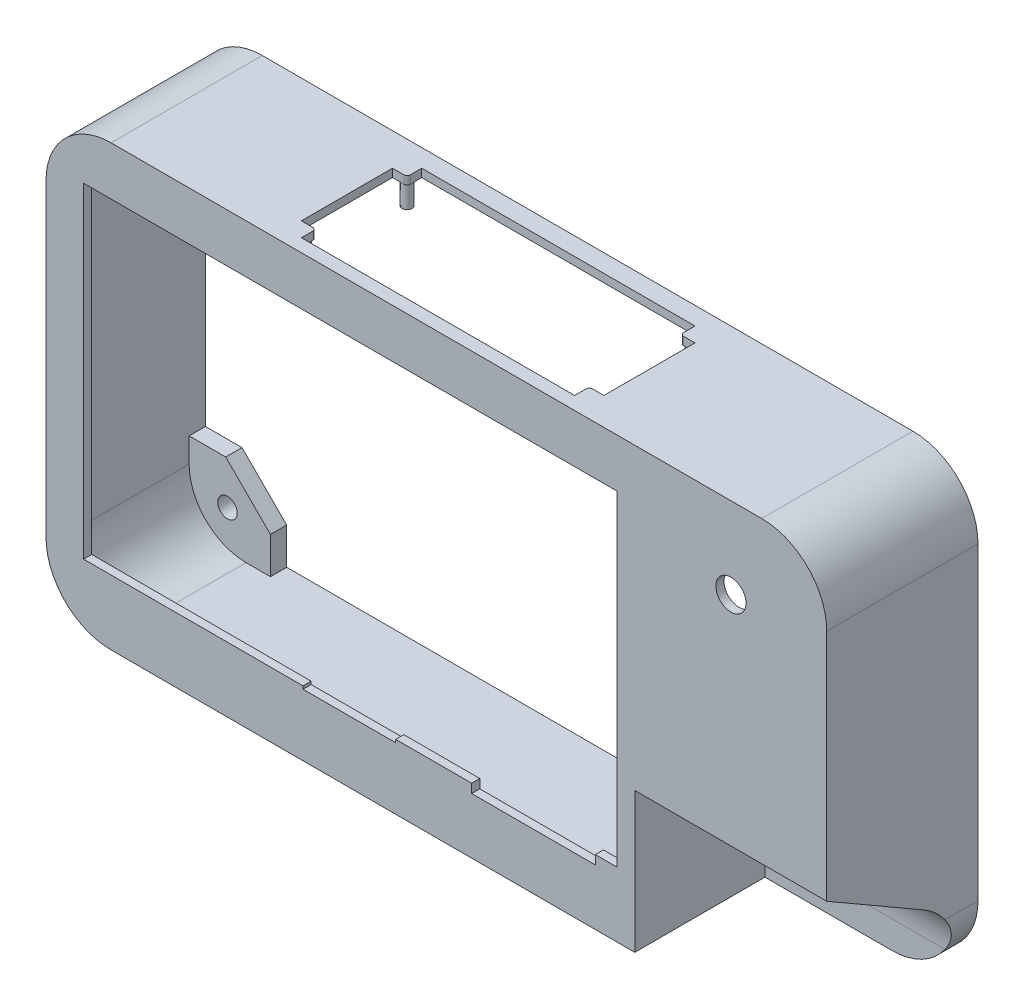
from build123d import *

# Parameters (mm, degrees)
BOSS_EXTRUDE1_DEPTH      = 40
CUT_EXTRUDE2_DEPTH       = 40
CUT_EXTRUDE3_DEPTH       = 59
SHELL2_START             = -40
SHELL2_DEPTH             = 37.5
SHELL2_START_2           = -117.5
SHELL2_2_DEPTH           = 235
SHELL2_3_DEPTH           = 176
SHELL2_START_3           = -2.5
SHELL2_4_DEPTH           = 42.5
CUT_EXTRUDE8_DEPTH       = 5
SKETCH8_W                = 5
SKETCH8_H                = 5
SKETCH8_RX               = 1
SKETCH8_RY               = 1
BOSS_EXTRUDE2_DEPTH      = 3.1
SKETCH9_R                = 4.635276172
CUT_EXTRUDE9_DEPTH       = 5
CUT_EXTRUDE10_DEPTH      = 144.374509589
CUT_EXTRUDE10_DEPTH_BACK = 144.374509589
SKETCH10_W               = 67.959096348
SKETCH10_H               = 169.269533221
FILLET2_R                = 20
SKETCH11_W               = 28.5
SKETCH11_H               = 0.9
CUT_EXTRUDE11_DEPTH      = 15
CUT_EXTRUDE12_DEPTH      = 7
SKETCH13_R               = 1.5
BOSS_EXTRUDE3_DEPTH      = 7
SKETCH14_W               = 22.744879455
SKETCH14_H               = 1.378979665
BOSS_EXTRUDE4_DEPTH      = 16
SKETCH15_R               = 1
CUT_EXTRUDE13_DEPTH      = 6
SKETCH17_W               = 16.744879455
SKETCH17_H               = 4.971074248
SKETCH17_W_2             = 11.65
SKETCH17_H_2             = 5.028925752
CUT_EXTRUDE14_DEPTH      = 6
SKETCH16_W               = 5.703112467
SKETCH16_H               = 1.378979665
BOSS_EXTRUDE5_DEPTH      = 25
BOSS_EXTRUDE6_DEPTH      = 8
BOSS_EXTRUDE6_DEPTH_BACK = 14
SKETCH20_W               = 5
SKETCH20_H               = 1.378979665
BOSS_EXTRUDE7_DEPTH      = 8
SKETCH21_R               = 1
CUT_EXTRUDE15_DEPTH      = 8
BOSS_EXTRUDE8_START      = -5
SKETCH22_R               = 3
BOSS_EXTRUDE8_DEPTH      = 5
MIRROR3_START            = -5
MIRROR3_COPY_1_SKETCH_R  = 3
MIRROR3_COPY_1_DEPTH     = 5


with BuildPart() as part:
    # Sketch2 → Boss-Extrude1 (new, symmetric)
    with BuildSketch(Plane.XY):
        with BuildLine():
            Line((-100, -67.5), (100, -67.5))
            ThreePointArc((100, -67.5), (114.142135624, -61.642135624), (120, -47.5))
            Line((120, -47.5), (120, 47.5))
            ThreePointArc((120, 47.5), (114.142135624, 61.642135624), (100, 67.5))
            Line((100, 67.5), (-100, 67.5))
            ThreePointArc((-100, 67.5), (-114.142135624, 61.642135624), (-120, 47.5))
            Line((-120, 47.5), (-120, -47.5))
            ThreePointArc((-120, -47.5), (-114.142135624, -61.642135624), (-100, -67.5))
        make_face()
    extrude(amount=BOSS_EXTRUDE1_DEPTH, both=True)

    # Sketch3 → Cut-Extrude2 (cut)
    with BuildSketch(Plane.XY.offset(40)):
        with BuildLine():
            Line((61, -47.5), (61, -67.5))
            Line((61, -67.5), (100, -67.5))
            ThreePointArc((100, -67.5), (114.142135624, -61.642135624), (120, -47.5))
            Line((120, -47.5), (61, -47.5))
        make_face()
    extrude(amount=-CUT_EXTRUDE2_DEPTH, mode=Mode.SUBTRACT)

    # Sketch4 → Cut-Extrude3 (cut)
    with BuildSketch(Plane(origin=(120, 0, 0), x_dir=(0, 0, -1), z_dir=(1, 0, 0))):
        Polygon((0, -47.5), (-40, -24.405989232), (-40, -47.5), align=None)
    extrude(amount=-CUT_EXTRUDE3_DEPTH, mode=Mode.SUBTRACT)

    # Shell2: read off the stored shape, not the designer's step
    # Shell2 outline → Shell2 (cut)
    with BuildSketch(Plane.XY.offset(SHELL2_START)):
        with BuildLine():
            Line((58.5, -65), (100, -65))
            ThreePointArc((100, -65), (112.374368671, -59.874368671), (117.5, -47.5))
            Line((117.5, -47.5), (117.5, 47.5))
            ThreePointArc((117.5, 47.5), (112.374368671, 59.874368671), (100, 65))
            Line((100, 65), (-100, 65))
            ThreePointArc((-100, 65), (-112.374368671, 59.874368671), (-117.5, 47.5))
            Line((-117.5, 47.5), (-117.5, -47.5))
            ThreePointArc((-117.5, -47.5), (-112.374368671, -59.874368671), (-100, -65))
            Line((-100, -65), (58.5, -65))
        make_face()
    extrude(amount=SHELL2_DEPTH, mode=Mode.SUBTRACT)

    # Shell2 2 outline → Shell2 2 (cut)
    with BuildSketch(Plane.YZ.offset(SHELL2_START_2)):
        Polygon((-22.962613559, 37.5), (-46.056624327, -2.5), (65, -2.5), (65, 37.5), align=None)
    extrude(amount=SHELL2_2_DEPTH, mode=Mode.SUBTRACT)

    # Shell2 3 outline → Shell2 3 (cut)
    with BuildSketch(Plane.YZ.offset(SHELL2_START_2)):
        Polygon((-65, 37.5), (-65, -2.5), (-46.056624327, -2.5), (-22.962613559, 37.5), align=None)
    extrude(amount=SHELL2_3_DEPTH, mode=Mode.SUBTRACT)

    # Shell2 4 outline → Shell2 4 (add)
    with BuildSketch(Plane.XY.offset(SHELL2_START_3)):
        with BuildLine():
            ThreePointArc((-100, -65), (-112.374368671, -59.874368671), (-117.5, -47.5))
            Line((-117.5, -47.5), (-117.5, -57.182458366))
            ThreePointArc((-117.5, -57.182458366), (-114.142135624, -61.642135624), (-109.682458366, -65))
            Line((-109.682458366, -65), (-100, -65))
        make_face()
        with BuildLine():
            ThreePointArc((-117.5, 47.5), (-112.374368671, 59.874368671), (-100, 65))
            Line((-100, 65), (-109.682458366, 65))
            ThreePointArc((-109.682458366, 65), (-114.142135624, 61.642135624), (-117.5, 57.182458366))
            Line((-117.5, 57.182458366), (-117.5, 47.5))
        make_face()
        with BuildLine():
            ThreePointArc((117.5, 57.182458366), (114.142135624, 61.642135624), (109.682458366, 65))
            Line((109.682458366, 65), (100, 65))
            ThreePointArc((100, 65), (112.374368671, 59.874368671), (117.5, 47.5))
            Line((117.5, 47.5), (117.5, 57.182458366))
        make_face()
    extrude(amount=SHELL2_4_DEPTH)

    # Sketch5 → Cut-Extrude8 (cut)
    with BuildSketch(Plane(origin=(0, -35.625, 20.56810334), x_dir=(1, 0, 0), z_dir=(0, -0.8660254037844417, 0.4999999999999947))):
        Polygon((101.124755189, 17.899421729), (78.474755189, 17.899421729), (78.474755189, 5.754854046), (78.474755189, 3.799421729), (101.124755189, 3.799421729), (101.124755189, 5.754854046), align=None)
    extrude(amount=-CUT_EXTRUDE8_DEPTH, mode=Mode.SUBTRACT)

    # Sketch8 → Boss-Extrude2 (add)
    # profile 1 of 4: a face of its own
    with BuildSketch(Plane(origin=(0, 0, 37.5), x_dir=(-1, 0, 0), z_dir=(0, 0, -1))):
        with Locations((-103.1, 53)):
            Rectangle(SKETCH8_W, SKETCH8_H)
        with Locations(Location((-103.1, 53), (0, 0, 135))):
            Ellipse(SKETCH8_RX, SKETCH8_RY, mode=Mode.SUBTRACT)
    # profile 2 of 4: a face of its own
    with BuildSketch(Plane(origin=(0, 0, 37.5), x_dir=(-1, 0, 0), z_dir=(0, 0, -1))):
        with Locations((-90.6, 53)):
            Rectangle(SKETCH8_W, SKETCH8_H)
        with Locations(Location((-90.6, 53), (0, 0, 135))):
            Ellipse(SKETCH8_RX, SKETCH8_RY, mode=Mode.SUBTRACT)
    # profile 3 of 4: a face of its own
    with BuildSketch(Plane(origin=(0, 0, 37.5), x_dir=(-1, 0, 0), z_dir=(0, 0, -1))):
        with Locations((-90.6, 32)):
            Rectangle(SKETCH8_W, SKETCH8_H)
        with Locations(Location((-90.6, 32), (0, 0, 135))):
            Ellipse(SKETCH8_RX, SKETCH8_RY, mode=Mode.SUBTRACT)
    # profile 4 of 4: a face of its own
    with BuildSketch(Plane(origin=(0, 0, 37.5), x_dir=(-1, 0, 0), z_dir=(0, 0, -1))):
        with Locations((-103.1, 32)):
            Rectangle(SKETCH8_W, SKETCH8_H)
        with Locations(Location((-103.1, 32), (0, 0, 135))):
            Ellipse(SKETCH8_RX, SKETCH8_RY, mode=Mode.SUBTRACT)
    extrude(amount=BOSS_EXTRUDE2_DEPTH)

    # Sketch9 → Cut-Extrude9 (cut)
    with BuildSketch(Plane.XY.offset(40)):
        with Locations((90.55, 42.5)):
            Circle(SKETCH9_R)
    extrude(amount=-CUT_EXTRUDE9_DEPTH, mode=Mode.SUBTRACT)

    # Sketch10 → Cut-Extrude10 (cut, two sides: drawn at the far end of the back side and taken through both)
    with BuildSketch(Plane(origin=(0, 0, 0), x_dir=(0, 0, -1), z_dir=(1, 0, 0)).offset(-CUT_EXTRUDE10_DEPTH_BACK)):
        with Locations((40.479548174, -4.240634214)):
            Rectangle(SKETCH10_W, SKETCH10_H)
    extrude(amount=CUT_EXTRUDE10_DEPTH + CUT_EXTRUDE10_DEPTH_BACK, mode=Mode.SUBTRACT)

    # Fillet2
    fillet2_edges = [part.edges().sort_by_distance(p)[0] for p in [
        (90.5, -47.5, 0),
        (88, -46.056624327, -2.5),
    ]]
    fillet(fillet2_edges, radius=FILLET2_R)

    # Sketch11 → Cut-Extrude11 (cut)
    with BuildSketch(Plane.XY.offset(40)):
        Polygon((-12.5, -47.55), (10.85, -47.55), (10.85, -47.8), (10.85, -50.3), (48.85, -50.3), (48.85, -47.8), (48.85, -47.55), (55.55, -47.55), (55.55, 52.55), (-108.45, 52.55), (-108.45, -47.55), (-41, -47.55), align=None)
        with Locations((-26.75, -48)):
            Rectangle(SKETCH11_W, SKETCH11_H)
    extrude(amount=-CUT_EXTRUDE11_DEPTH, mode=Mode.SUBTRACT)

    # Sketch12 → Cut-Extrude12 (cut)
    with BuildSketch(Plane(origin=(0, 67.5, 0), x_dir=(1, 0, 0), z_dir=(0, 1, 0))):
        with BuildLine():
            Line((-50, -3.5), (-50, -31.5))
            Line((-50, -31.5), (-46.5, -31.5))
            ThreePointArc((-46.5, -31.5), (-45.792893219, -31.792893219), (-45.5, -32.5))
            Line((-45.5, -32.5), (-45.5, -36))
            Line((-45.5, -36), (38.5, -36))
            Line((38.5, -36), (38.5, -32.5))
            ThreePointArc((38.5, -32.5), (38.792893219, -31.792893219), (39.5, -31.5))
            Line((39.5, -31.5), (43, -31.5))
            Line((43, -31.5), (43, -3.5))
            Line((43, -3.5), (39.5, -3.5))
            ThreePointArc((39.5, -3.5), (38.792893219, -3.207106781), (38.5, -2.5))
            Line((38.5, -2.5), (38.5, 1))
            Line((38.5, 1), (-45.5, 1))
            Line((-45.5, 1), (-45.5, -2.5))
            ThreePointArc((-45.5, -2.5), (-45.792893219, -3.207106781), (-46.5, -3.5))
            Line((-46.5, -3.5), (-50, -3.5))
        make_face()
    extrude(amount=-CUT_EXTRUDE12_DEPTH, mode=Mode.SUBTRACT)

    # Sketch13 → Boss-Extrude3 (add)
    with BuildSketch(Plane.XZ.offset(-65)):
        with Locations(Location((40.25, 33.25, 0), (0, 0, 90))):
            Circle(SKETCH13_R)
        with Locations(Location((-47.25, 33.25, 0), (0, 0, 90))):
            Circle(SKETCH13_R)
        with Locations(Location((-47.25, 1.75, 0), (0, 0, 90))):
            Circle(SKETCH13_R)
        with Locations(Location((40.25, 1.75, 0), (0, 0, 90))):
            Circle(SKETCH13_R)
    extrude(amount=BOSS_EXTRUDE3_DEPTH)

    # Sketch14 → Boss-Extrude4 (add)
    with BuildSketch(Plane(origin=(0, -33.459936491, 19.31810334), x_dir=(1, 0, 0), z_dir=(0, 0.8660254037844417, -0.4999999999999947))):
        with Locations((89.752315462, -3.109931897)):
            Rectangle(SKETCH14_W, SKETCH14_H)
    extrude(amount=BOSS_EXTRUDE4_DEPTH)

    # Sketch15 → Cut-Extrude13 (cut)
    with BuildSketch(Plane(origin=(0, 1.899710865, 3.290395737), x_dir=(1, 0, 0), z_dir=(0, 0.49999999999999484, 0.8660254037844418))):
        with Locations(Location((81.474755189, -27.33620668, 0), (0, 0, 270))):
            Circle(SKETCH15_R)
        with Locations(Location((98.124755189, -27.33620668, 0), (0, 0, 270))):
            Circle(SKETCH15_R)
    extrude(amount=-CUT_EXTRUDE13_DEPTH, mode=Mode.SUBTRACT)

    # Sketch17 → Cut-Extrude14 (cut)
    with BuildSketch(Plane(origin=(0, 1.210221032, 2.096164316), x_dir=(-1, 0, 0), z_dir=(0, -0.4999999999999947, -0.8660254037844417))):
        with Locations((-89.752315462, -33.150669556)):
            Rectangle(SKETCH17_W, SKETCH17_H)
        with Locations((-89.799755189, -28.150669556)):
            Rectangle(SKETCH17_W_2, SKETCH17_H_2)
    extrude(amount=-CUT_EXTRUDE14_DEPTH, mode=Mode.SUBTRACT)

    # Sketch16 → Boss-Extrude5 (add)
    with BuildSketch(Plane(origin=(0, -19.60353003, 11.31810334), x_dir=(1, 0, 0), z_dir=(0, 0.8660254037844417, -0.4999999999999947))):
        with Locations((89.752315462, -3.109931897)):
            Rectangle(SKETCH16_W, SKETCH16_H)
    extrude(amount=BOSS_EXTRUDE5_DEPTH)

    # Sketch19 → Boss-Extrude6 (add, two sides: drawn at the far end of the back side and taken through both)
    with BuildSketch(Plane.ZY.offset(-86.900759228).offset(-BOSS_EXTRUDE6_DEPTH_BACK)):
        Polygon((3.414267656, -1.072800922), (4.608499077, -0.38331109), (2.108499077, 3.946815929), (0.914267656, 3.257326097), align=None)
    extrude(amount=BOSS_EXTRUDE6_DEPTH + BOSS_EXTRUDE6_DEPTH_BACK)

    # Sketch20 → Boss-Extrude7 (add)
    with BuildSketch(Plane(origin=(0, 2.047105065, -1.18189666), x_dir=(1, 0, 0), z_dir=(0, 0.8660254037844419, -0.4999999999999946))):
        with Locations((98.400759228, -3.109931897)):
            Rectangle(SKETCH20_W, SKETCH20_H)
        with Locations((81.400759228, -3.109931897)):
            Rectangle(SKETCH20_W, SKETCH20_H)
    extrude(amount=BOSS_EXTRUDE7_DEPTH)

    # Sketch21 → Cut-Extrude15 (cut)
    with BuildSketch(Plane(origin=(0, 1.899710865, 3.290395737), x_dir=(1, 0, 0), z_dir=(0, 0.49999999999999484, 0.8660254037844418))):
        with Locations(Location((81.474755189, 7.66379332, 0), (0, 0, 270))):
            Circle(SKETCH21_R)
        with Locations(Location((98.124755189, 7.66379332, 0), (0, 0, 270))):
            Circle(SKETCH21_R)
    extrude(amount=-CUT_EXTRUDE15_DEPTH, mode=Mode.SUBTRACT)

    # Sketch22 → Boss-Extrude8 (add)
    with BuildSketch(Plane(origin=(0, 0, -6.5), x_dir=(-1, 0, 0), z_dir=(0, 0, -1)).offset(BOSS_EXTRUDE8_START)):
        with BuildLine():
            Line((-120, -40), (-106.25, -40))
            Line((-106.25, -40), (-92.5, -53.75))
            Line((-92.5, -53.75), (-92.5, -67.5))
            Line((-92.5, -67.5), (-100, -67.5))
            ThreePointArc((-100, -67.5), (-114.142135624, -61.642135624), (-120, -47.5))
            Line((-120, -47.5), (-120, -40))
        make_face()
        with Locations(Location((-105.710599836, -53.210599836, 0), (0, 0, 90))):
            Circle(SKETCH22_R, mode=Mode.SUBTRACT)
    boss_extrude8 = extrude(amount=BOSS_EXTRUDE8_DEPTH)

    # Mirror2: Boss-Extrude8 across plane
    add(boss_extrude8.mirror(Plane.ZX))

    # Mirror3: Boss-Extrude8 across plane
    add(boss_extrude8.mirror(Plane(origin=(0, 0, 0), x_dir=(0, 0, 1), z_dir=(1, 0, 0))))

    # Mirror3 copy 1 sketch → Mirror3 copy 1 (add)
    with BuildSketch(Plane(origin=(0, 0, -6.5), x_dir=(1, 0, 0), z_dir=(0, 0, -1)).offset(MIRROR3_START)):
        with BuildLine():
            Line((-120, -40), (-106.25, -40))
            Line((-106.25, -40), (-92.5, -53.75))
            Line((-92.5, -53.75), (-92.5, -67.5))
            Line((-92.5, -67.5), (-100, -67.5))
            ThreePointArc((-100, -67.5), (-114.142135624, -61.642135624), (-120, -47.5))
            Line((-120, -47.5), (-120, -40))
        make_face()
        with Locations(Location((-105.710599836, -53.210599836, 0), (0, 0, 90))):
            Circle(MIRROR3_COPY_1_SKETCH_R, mode=Mode.SUBTRACT)
    extrude(amount=MIRROR3_COPY_1_DEPTH)


solid = part.part
